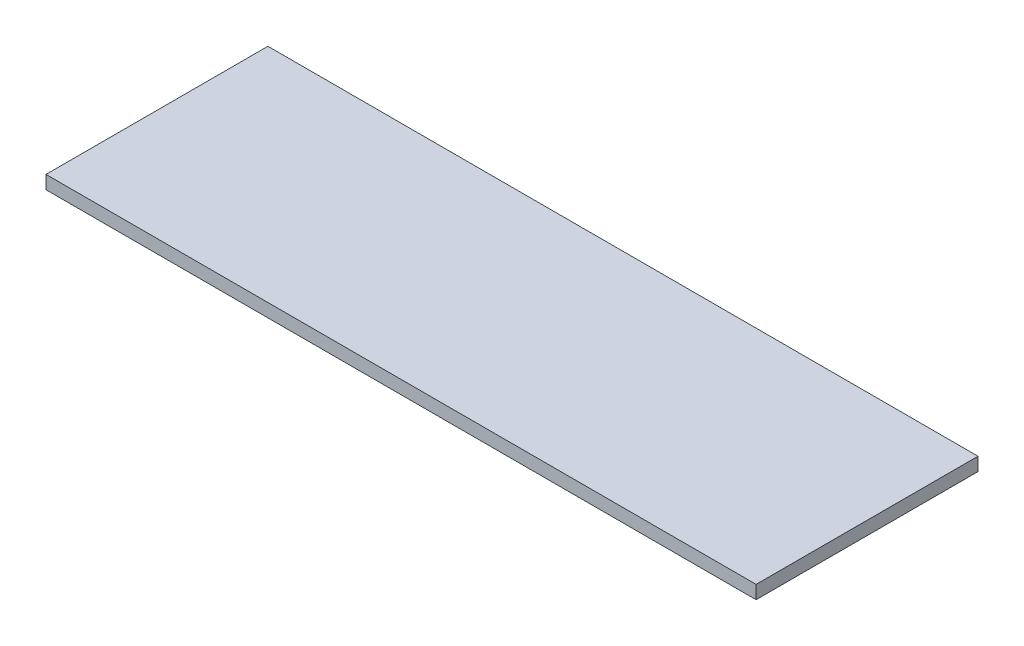
from build123d import *

# Parameters (mm, degrees)
SKETCH1_W           = 160
SKETCH1_H           = 50
BOSS_EXTRUDE1_DEPTH = 3


with BuildPart() as part:
    # Sketch1 → Boss-Extrude1 (new body)
    with BuildSketch(Plane(origin=(0, 0, 0), x_dir=(1, 0, 0), z_dir=(0, 1, 0))):
        Rectangle(SKETCH1_W, SKETCH1_H)
    extrude(amount=BOSS_EXTRUDE1_DEPTH)


solid = part.part
